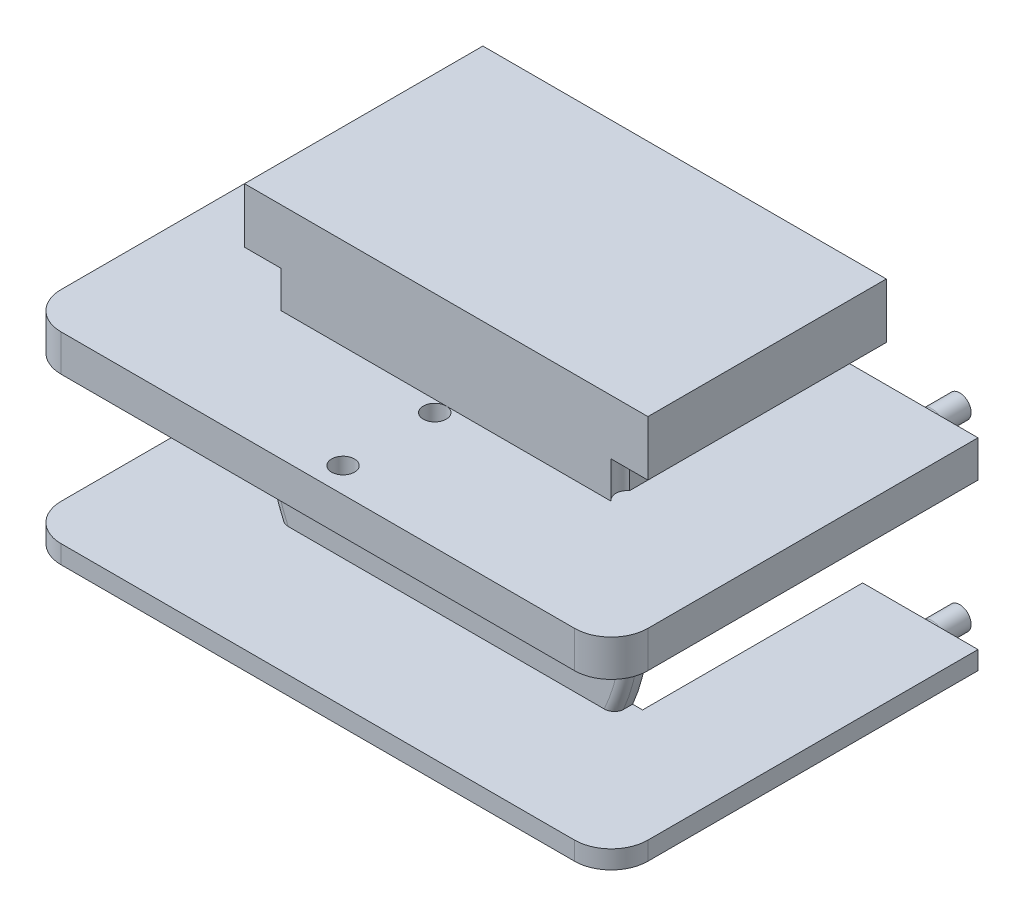
from build123d import *

# Parameters (mm, degrees)
BOSS_EXTRUDE1_DEPTH     = 1
SKETCH2_R               = 1.475
BOSS_EXTRUDE2_DEPTH     = 14
SKETCH3_R               = 1.8
BOSS_EXTRUDE3_DEPTH     = 1
SKETCH4_W               = 2
SKETCH4_H               = 17
BOSS_EXTRUDE4_DEPTH     = 12
SKETCH5_W               = 18
SKETCH5_H               = 2
BOSS_EXTRUDE5_DEPTH     = 12
SKETCH6_W               = 13
SKETCH6_H               = 2
BOSS_EXTRUDE6_DEPTH     = 5
BOSS_EXTRUDE7_DEPTH     = 12
CUT_EXTRUDE1_DEPTH      = 24.366642891
SKETCH9_W               = 2.937742252
SKETCH9_H               = 8
CUT_EXTRUDE2_DEPTH      = 12
CUT_EXTRUDE11_START     = -12
SKETCH21_R              = 10.5
SKETCH21_R_2            = 1.8
CUT_EXTRUDE11_DEPTH     = 12
SKETCH10_W              = 32
SKETCH10_H              = 2
BOSS_EXTRUDE8_DEPTH     = 7
FILLET1_R               = 0.5
SKETCH11_R              = 0.625
BOSS_EXTRUDE9_DEPTH     = 2
SKETCH14_W              = 2
SKETCH14_H              = 2
CUT_EXTRUDE5_DEPTH      = 28.874719859
SKETCH12_R              = 0.675
CUT_EXTRUDE3_DEPTH      = 2.5
CUT_EXTRUDE6_DEPTH      = 2
FILLET2_R               = 0.5
FILLET3_R               = 0.5
FILLET4_R               = 2
CUT_EXTRUDE7_DEPTH      = 28.221315288
CUT_EXTRUDE7_DEPTH_BACK = 1
SKETCH19_R              = 0.625
CUT_EXTRUDE9_DEPTH      = 2


with BuildPart() as part:
    # Sketch1 → Boss-Extrude1 (new body)
    with BuildSketch(Plane.XY):
        Polygon((-11, 6), (-11, 11), (11, 11), (11, 6), (11, -6), (-11, -6), align=None)
    extrude(amount=BOSS_EXTRUDE1_DEPTH)

    # Sketch2 → Boss-Extrude2 (add)
    with BuildSketch(Plane(origin=(0, 0, 0), x_dir=(-1, 0, 0), z_dir=(0, 0, -1))):
        with Locations(Location((0, 0, 0), (0, 0, 180))):
            Circle(SKETCH2_R)
    extrude(amount=BOSS_EXTRUDE2_DEPTH)

    # Sketch3 → Boss-Extrude3 (add)
    with BuildSketch(Plane(origin=(0, 0, 0), x_dir=(-1, 0, 0), z_dir=(0, 0, -1))):
        with Locations(Location((0, 0, 0), (0, 0, 180))):
            Circle(SKETCH3_R)
    extrude(amount=BOSS_EXTRUDE3_DEPTH)

    # Sketch4 → Boss-Extrude4 (add)
    with BuildSketch(Plane(origin=(0, 0, 0), x_dir=(-1, 0, 0), z_dir=(0, 0, -1))):
        with Locations((10, 2.5)):
            Rectangle(SKETCH4_W, SKETCH4_H)
        with Locations((-10, 2.5)):
            Rectangle(SKETCH4_W, SKETCH4_H)
    extrude(amount=BOSS_EXTRUDE4_DEPTH)

    # Sketch5 → Boss-Extrude5 (add)
    with BuildSketch(Plane(origin=(0, 0, 0), x_dir=(-1, 0, 0), z_dir=(0, 0, -1))):
        with Locations((0, 10)):
            Rectangle(SKETCH5_W, SKETCH5_H)
    extrude(amount=BOSS_EXTRUDE5_DEPTH)

    # Sketch6 → Boss-Extrude6 (add)
    with BuildSketch(Plane(origin=(11, 0, 0), x_dir=(0, 0, -1), z_dir=(1, 0, 0))):
        with Locations((5.5, -5)):
            Rectangle(SKETCH6_W, SKETCH6_H)
        with Locations((5.5, 5)):
            Rectangle(SKETCH6_W, SKETCH6_H)
    boss_extrude6 = extrude(amount=BOSS_EXTRUDE6_DEPTH)

    # Mirror1: Boss-Extrude6 across plane
    add(boss_extrude6.mirror(Plane(origin=(0, 0, 0), x_dir=(0, 0, 1), z_dir=(1, 0, 0))))

    # Sketch7 → Boss-Extrude7 (add)
    with BuildSketch(Plane(origin=(0, 0, -12), x_dir=(-1, 0, 0), z_dir=(0, 0, -1))):
        with BuildLine():
            ThreePointArc((-6.708203932, -6), (-8.407551231, -3.211398808), (-9, 0))
            Line((-9, 0), (-9, -6))
            Line((-9, -6), (-6.708203932, -6))
        make_face()
        with BuildLine():
            Line((-9, 9), (-9, 0))
            ThreePointArc((-9, 0), (-6.363961031, 6.363961031), (0, 9))
            Line((0, 9), (-9, 9))
        make_face()
    boss_extrude7 = extrude(amount=-BOSS_EXTRUDE7_DEPTH)

    # Sketch8 → Cut-Extrude1 (cut, through all)
    with BuildSketch(Plane(origin=(0, 0, -12), x_dir=(-1, 0, 0), z_dir=(0, 0, -1))):
        with BuildLine():
            Line((-11, 4), (-9.16515139, 4))
            ThreePointArc((-9.16515139, 4), (-10, 0), (-9.16515139, -4))
            Line((-9.16515139, -4), (-11, -4))
            Line((-11, -4), (-11, 4))
        make_face()
    cut_extrude1 = extrude(amount=-CUT_EXTRUDE1_DEPTH, mode=Mode.SUBTRACT)

    # Sketch9 → Cut-Extrude2 (cut)
    with BuildSketch(Plane(origin=(0, 0, -12), x_dir=(-1, 0, 0), z_dir=(0, 0, -1))):
        with Locations((-9.531128874, 0)):
            Rectangle(SKETCH9_W, SKETCH9_H)
    cut_extrude2 = extrude(amount=-CUT_EXTRUDE2_DEPTH, mode=Mode.SUBTRACT)

    # Mirror2: Boss-Extrude7, Cut-Extrude1, Cut-Extrude2 across plane
    add(boss_extrude7.mirror(Plane(origin=(0, 0, 0), x_dir=(0, 0, 1), z_dir=(1, 0, 0))))
    add(cut_extrude1.mirror(Plane(origin=(0, 0, 0), x_dir=(0, 0, 1), z_dir=(1, 0, 0))), mode=Mode.SUBTRACT)
    add(cut_extrude2.mirror(Plane(origin=(0, 0, 0), x_dir=(0, 0, 1), z_dir=(1, 0, 0))), mode=Mode.SUBTRACT)

    # Sketch21 → Cut-Extrude11 (cut)
    with BuildSketch(Plane(origin=(0, 0, -12), x_dir=(-1, 0, 0), z_dir=(0, 0, -1)).offset(CUT_EXTRUDE11_START)):
        Circle(SKETCH21_R)
        with Locations(Location((0, 0, 0), (0, 0, 180))):
            Circle(SKETCH21_R_2, mode=Mode.SUBTRACT)
    extrude(amount=CUT_EXTRUDE11_DEPTH, mode=Mode.SUBTRACT)

    # Sketch10 → Boss-Extrude8 (add)
    with BuildSketch(Plane.XY.offset(1)):
        with Locations((0, -5)):
            Rectangle(SKETCH10_W, SKETCH10_H)
        with Locations((0, 5)):
            Rectangle(SKETCH10_W, SKETCH10_H)
    extrude(amount=BOSS_EXTRUDE8_DEPTH)

    # Fillet1
    fillet1_edges = [part.edges().sort_by_distance(p)[0] for p in [
        (10, 0, 1),
        (-10, 0, 1),
    ]]
    fillet(fillet1_edges, radius=FILLET1_R)

    # Sketch11 → Boss-Extrude9 (add)
    with BuildSketch(Plane(origin=(0, 0, -12), x_dir=(-1, 0, 0), z_dir=(0, 0, -1))):
        with Locations(Location((-13, -5, 0), (0, 0, 180))):
            Circle(SKETCH11_R)
    boss_extrude9 = extrude(amount=BOSS_EXTRUDE9_DEPTH)

    # Sketch14 → Cut-Extrude5 (cut, through all)
    with BuildSketch(Plane(origin=(0, 0, -12), x_dir=(-1, 0, 0), z_dir=(0, 0, -1))):
        with Locations((10, 7)):
            Rectangle(SKETCH14_W, SKETCH14_H)
        with Locations((-10, 7)):
            Rectangle(SKETCH14_W, SKETCH14_H)
    extrude(amount=-CUT_EXTRUDE5_DEPTH, mode=Mode.SUBTRACT)

    # Sketch12 → Cut-Extrude3 (cut)
    with BuildSketch(Plane(origin=(0, 0, -12), x_dir=(-1, 0, 0), z_dir=(0, 0, -1))):
        with Locations((13, -5)):
            Circle(SKETCH12_R)
    cut_extrude3 = extrude(amount=-CUT_EXTRUDE3_DEPTH, mode=Mode.SUBTRACT)

    # Sketch16 → Cut-Extrude6 (cut)
    with BuildSketch(Plane(origin=(0, 6, 0), x_dir=(1, 0, 0), z_dir=(0, 1, 0))):
        with BuildLine():
            Line((-9, 0), (-9, -1))
            ThreePointArc((-9, -1), (-8.75, -0.5), (-9, 0))
        make_face()
    cut_extrude6 = extrude(amount=CUT_EXTRUDE6_DEPTH, mode=Mode.SUBTRACT)

    # Mirror3: Boss-Extrude9, Cut-Extrude3 across plane
    add(boss_extrude9.mirror(Plane.ZX))
    add(cut_extrude3.mirror(Plane.ZX), mode=Mode.SUBTRACT)

    # Mirror4: Cut-Extrude6 across plane
    add(cut_extrude6.mirror(Plane(origin=(0, 0, 0), x_dir=(0, 0, 1), z_dir=(1, 0, 0))), mode=Mode.SUBTRACT)

    # Fillet2
    fillet2_edges = [part.edges().sort_by_distance(p)[0] for p in [
        (12.375, -5, -12),
        (12.375, 5, -12),
    ]]
    fillet(fillet2_edges, radius=FILLET2_R)

    # Fillet3
    # the kernel refuses this fillet: 0.5 mm, written as the material it takes off along each edge
    with BuildSketch(Plane(origin=(-13, -5, -12), x_dir=(-1, 0, 0), z_dir=(0, -1, 0))) as fillet3_piece_1:
        with BuildLine():
            CenterArc((0.675 + FILLET3_R, -FILLET3_R), FILLET3_R, 90, 90)
            Line((0.675, -FILLET3_R), (0.675, 0))
            Line((0.675, 0), (0.675 + FILLET3_R, 0))
        make_face()
    revolve(axis=Axis((-13, -5, -12), (0, 0, -1)), mode=Mode.SUBTRACT)
    with BuildSketch(Plane(origin=(-13, 5, -12), x_dir=(-1, 0, 0), z_dir=(0, 1, 0))) as fillet3_piece_2:
        with BuildLine():
            CenterArc((0.675 + FILLET3_R, FILLET3_R), FILLET3_R, 180, 90)
            Line((0.675, FILLET3_R), (0.675, 0))
            Line((0.675, 0), (0.675 + FILLET3_R, 0))
        make_face()
    revolve(axis=Axis((-13, 5, -12), (0, 0, 1)), mode=Mode.SUBTRACT)

    # Fillet4
    fillet4_edges = [part.edges().sort_by_distance(p)[0] for p in [
        (16, -5, 8),
        (-16, -5, 8),
        (-16, 5, 8),
        (16, 5, 8),
    ]]
    fillet(fillet4_edges, radius=FILLET4_R)

    # Sketch17 → Cut-Extrude7 (cut, two sides: drawn at the far end of the back side and taken through both)
    with BuildSketch(Plane.XZ.offset(6).offset(-CUT_EXTRUDE7_DEPTH_BACK)):
        with BuildLine():
            Line((-16, 6), (-16, -12))
            Line((-16, -12), (-14.5, -12))
            Line((-14.5, -12), (-14.5, 6))
            ThreePointArc((-14.5, 6), (-14.353553391, 6.353553391), (-14, 6.5))
            Line((-14, 6.5), (14, 6.5))
            ThreePointArc((14, 6.5), (14.353553391, 6.353553391), (14.5, 6))
            Line((14.5, 6), (14.5, -12))
            Line((14.5, -12), (16, -12))
            Line((16, -12), (16, 6))
            ThreePointArc((16, 6), (15.414213562, 7.414213562), (14, 8))
            Line((14, 8), (-14, 8))
            ThreePointArc((-14, 8), (-15.414213562, 7.414213562), (-16, 6))
        make_face()
    extrude(amount=CUT_EXTRUDE7_DEPTH + CUT_EXTRUDE7_DEPTH_BACK, mode=Mode.SUBTRACT)

    # Sketch19 → Cut-Extrude9 (cut)
    with BuildSketch(Plane(origin=(0, 6, 0), x_dir=(1, 0, 0), z_dir=(0, 1, 0))):
        with Locations(Location((0, -1.625, 0), (0, 0, 90))):
            Circle(SKETCH19_R)
        with Locations(Location((0, -6.625, 0), (0, 0, 270))):
            Circle(SKETCH19_R)
    extrude(amount=-CUT_EXTRUDE9_DEPTH, mode=Mode.SUBTRACT)


solid = part.part
